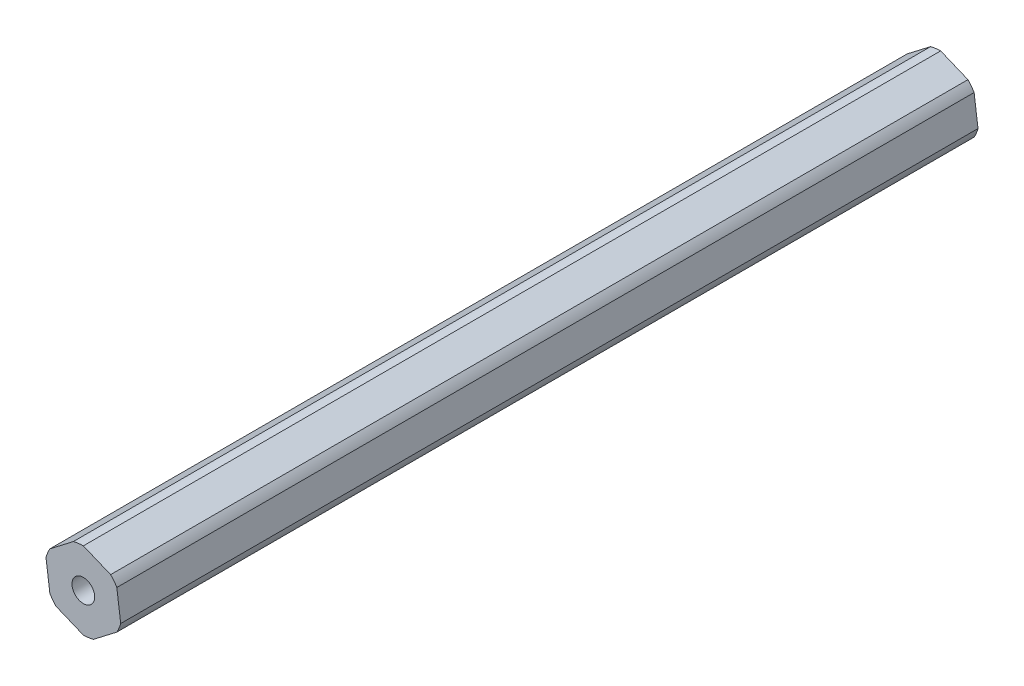
from build123d import *

# Parameters (mm, degrees)
BOSS_EXTRUDE1_DEPTH        = 152.4
F_10_32_TAPPED_HOLE2_D     = 4.0386
F_10_32_TAPPED_HOLE2_DEPTH = 13.6144
F_10_32_TAPPED_HOLE2_TIP   = 1.213317848


with BuildPart() as part:
    # Sketch1 → Boss-Extrude1 (new body)
    with BuildSketch(Plane.XY):
        with BuildLine():
            Line((-1.789892893, 6.63346078), (-5.950200742, 3.43535))
            ThreePointArc((-5.950200742, 3.43535), (-6.35, 2.623741315), (-6.639691997, 1.766637675))
            Line((-6.639691997, 1.766637675), (-5.950200742, -3.43535))
            ThreePointArc((-5.950200742, -3.43535), (-5.447226632, -4.187390656), (-4.849799104, -4.866823105))
            Line((-4.849799104, -4.866823105), (0, -6.8707))
            ThreePointArc((0, -6.8707), (0.902773368, -6.811131972), (1.789892893, -6.63346078))
            Line((1.789892893, -6.63346078), (5.950200742, -3.43535))
            ThreePointArc((5.950200742, -3.43535), (6.35, -2.623741315), (6.639691997, -1.766637675))
            Line((6.639691997, -1.766637675), (5.950200742, 3.43535))
            ThreePointArc((5.950200742, 3.43535), (5.447226632, 4.187390656), (4.849799104, 4.866823105))
            Line((4.849799104, 4.866823105), (0, 6.8707))
            ThreePointArc((0, 6.8707), (-0.902773368, 6.811131972), (-1.789892893, 6.63346078))
        make_face()
    extrude(amount=BOSS_EXTRUDE1_DEPTH)

    # #10-32 Tapped Hole2
    with Locations(Plane.XY.offset(152.4)):
        with Locations((0, 0)):
            Hole(F_10_32_TAPPED_HOLE2_D / 2, depth=F_10_32_TAPPED_HOLE2_DEPTH)
            with Locations((0, 0, -(F_10_32_TAPPED_HOLE2_DEPTH + F_10_32_TAPPED_HOLE2_TIP / 2))):  # 118° drill point
                Cone(0, F_10_32_TAPPED_HOLE2_D / 2, F_10_32_TAPPED_HOLE2_TIP, mode=Mode.SUBTRACT)


solid = part.part
